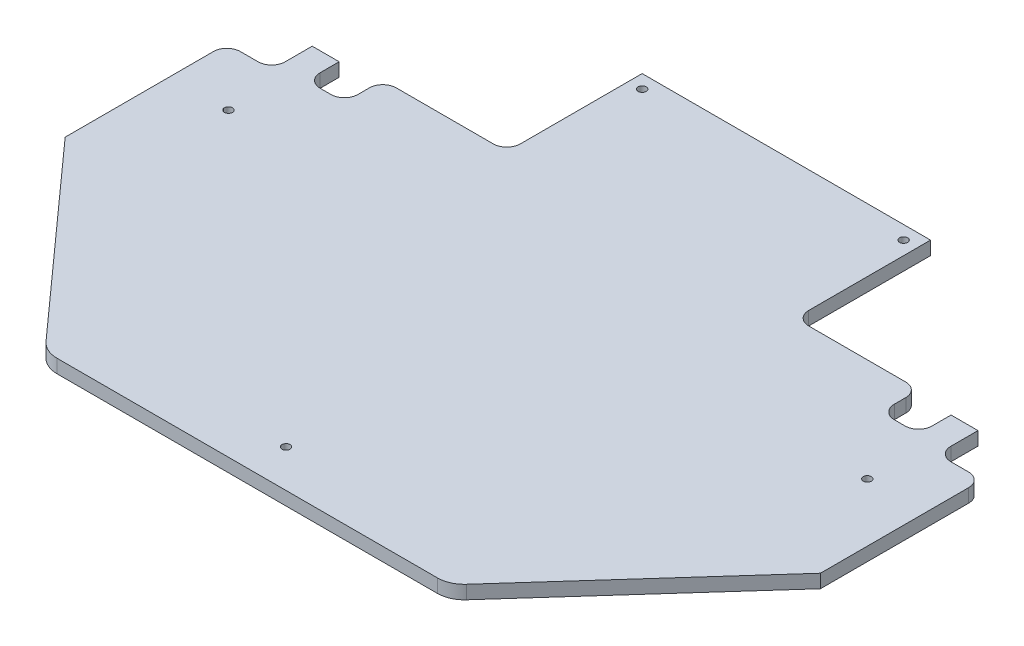
from build123d import *

# Parameters (mm, degrees)
ESQUISSE1_W              = 280.2
ESQUISSE1_H              = 276.282873123
BOSS_EXTRU_1_DEPTH       = 5
ENL_V_MAT_EXTRU_3_DEPTH  = 283.344868376
ENL_V_MAT_EXTRU_5_DEPTH  = 283.344868376
ESQUISSE8_R              = 1.5
ENL_V_MAT_EXTRU_8_DEPTH  = 283.344868376
ESQUISSE10_R             = 1.5
ENL_V_MAT_EXTRU_11_DEPTH = 283.344868376
ENL_V_MAT_EXTRU_15_DEPTH = 283.344868376
CONG_1_R                 = 10
ESQUISSE13_R             = 1.5
ENL_V_MAT_EXTRU_16_DEPTH = 220.422993326


with BuildPart() as part:
    # Esquisse1 → Boss.-Extru.1 (new body)
    with BuildSketch(Plane(origin=(0, 0, 0), x_dir=(1, 0, 0), z_dir=(0, 1, 0))):
        with Locations((0, -106.941436562)):
            Rectangle(ESQUISSE1_W, ESQUISSE1_H)
    extrude(amount=BOSS_EXTRU_1_DEPTH)

    # Esquisse4 → Enlèv. mat.-Extru.3 (cut, through all)
    with BuildSketch(Plane(origin=(0, 5, 0), x_dir=(1, 0, 0), z_dir=(0, 1, 0))):
        with BuildLine():
            Line((140.1, -245.082873123), (101.1, -245.082873123))
            ThreePointArc((101.1, -245.082873123), (128.677164466, -233.660037589), (140.1, -206.082873123))
            Line((140.1, -206.082873123), (140.1, -245.082873123))
        make_face()
        with BuildLine():
            Line((-101.1, -245.082873123), (-140.1, -245.082873123))
            Line((-140.1, -245.082873123), (-140.1, -206.082873123))
            ThreePointArc((-140.1, -206.082873123), (-128.677164466, -233.660037589), (-101.1, -245.082873123))
        make_face()
    extrude(amount=-ENL_V_MAT_EXTRU_3_DEPTH, mode=Mode.SUBTRACT)

    # Esquisse6 → Enlèv. mat.-Extru.5 (cut, through all)
    with BuildSketch(Plane(origin=(0, 5, 0), x_dir=(1, 0, 0), z_dir=(0, 1, 0))):
        with BuildLine():
            Line((140.1, 31.2), (53.5, 31.2))
            Line((53.5, 31.2), (53.5, -14))
            ThreePointArc((53.5, -14), (54.964466094, -17.535533906), (58.5, -19))
            Line((58.5, -19), (94.5, -19))
            ThreePointArc((94.5, -19), (98.035533906, -20.464466094), (99.5, -24))
            Line((99.5, -24), (99.5, -28.25))
            ThreePointArc((99.5, -28.25), (100.964466094, -31.785533906), (104.5, -33.25))
            Line((104.5, -33.25), (108.5, -33.25))
            ThreePointArc((108.5, -33.25), (112.035533906, -31.785533906), (113.5, -28.25))
            Line((113.5, -28.25), (113.5, -21.2))
            Line((113.5, -21.2), (123.5, -21.2))
            Line((123.5, -21.2), (123.5, -31.25))
            ThreePointArc((123.5, -31.25), (124.964466094, -34.785533906), (128.5, -36.25))
            Line((128.5, -36.25), (135.1, -36.25))
            ThreePointArc((135.1, -36.25), (138.635533906, -37.714466094), (140.1, -41.25))
            Line((140.1, -41.25), (140.1, 31.2))
        make_face()
        with BuildLine():
            Line((-53.5, -14), (-53.5, 31.2))
            Line((-53.5, 31.2), (-140.1, 31.2))
            Line((-140.1, 31.2), (-140.1, -41.25))
            ThreePointArc((-140.1, -41.25), (-138.635533906, -37.714466094), (-135.1, -36.25))
            Line((-135.1, -36.25), (-128.5, -36.25))
            ThreePointArc((-128.5, -36.25), (-124.964466094, -34.785533906), (-123.5, -31.25))
            Line((-123.5, -31.25), (-123.5, -21.2))
            Line((-123.5, -21.2), (-113.5, -21.2))
            Line((-113.5, -21.2), (-113.5, -28.25))
            ThreePointArc((-113.5, -28.25), (-112.035533906, -31.785533906), (-108.5, -33.25))
            Line((-108.5, -33.25), (-104.5, -33.25))
            ThreePointArc((-104.5, -33.25), (-100.964466094, -31.785533906), (-99.5, -28.25))
            Line((-99.5, -28.25), (-99.5, -24))
            ThreePointArc((-99.5, -24), (-98.035533906, -20.464466094), (-94.5, -19))
            Line((-94.5, -19), (-58.5, -19))
            ThreePointArc((-58.5, -19), (-54.964466094, -17.535533906), (-53.5, -14))
        make_face()
    extrude(amount=-ENL_V_MAT_EXTRU_5_DEPTH, mode=Mode.SUBTRACT)

    # Esquisse8 → Enlèv. mat.-Extru.8 (cut, through all)
    with BuildSketch(Plane.XZ):
        with Locations((-48.5, -26.2)):
            Circle(ESQUISSE8_R)
        with Locations((48.5, -26.2)):
            Circle(ESQUISSE8_R)
    extrude(amount=-ENL_V_MAT_EXTRU_8_DEPTH, mode=Mode.SUBTRACT)

    # Esquisse10 → Enlèv. mat.-Extru.11 (cut, through all)
    with BuildSketch(Plane(origin=(0, 5, 0), x_dir=(1, 0, 0), z_dir=(0, 1, 0))):
        with Locations((118.5, -57.265046493)):
            Circle(ESQUISSE10_R)
        with Locations((-118.5, -57.265046493)):
            Circle(ESQUISSE10_R)
    extrude(amount=-ENL_V_MAT_EXTRU_11_DEPTH, mode=Mode.SUBTRACT)

    # Esquisse12 → Enlèv. mat.-Extru.15 (cut, through all)
    with BuildSketch(Plane(origin=(0, 5, 0), x_dir=(1, 0, 0), z_dir=(0, 1, 0))):
        Polygon((-140.1, -96.25), (-75, -168.8), (75, -168.8), (140.1, -96.25), (146.03275504, -294.983631094), (-140.1, -294.983631094), align=None)
    extrude(amount=-ENL_V_MAT_EXTRU_15_DEPTH, mode=Mode.SUBTRACT)

    # Congé1
    cong_1_edges = [part.edges().sort_by_distance(p)[0] for p in [
        (-75, 2.5, 168.8),
        (75, 2.5, 168.8),
    ]]
    fillet(cong_1_edges, radius=CONG_1_R)

    # Esquisse13 → Enlèv. mat.-Extru.16 (cut, through all)
    with BuildSketch(Plane(origin=(0, 5, 0), x_dir=(1, 0, 0), z_dir=(0, 1, 0))):
        with Locations((0.38736006, -154.8)):
            Circle(ESQUISSE13_R)
    extrude(amount=-ENL_V_MAT_EXTRU_16_DEPTH, mode=Mode.SUBTRACT)


solid = part.part
